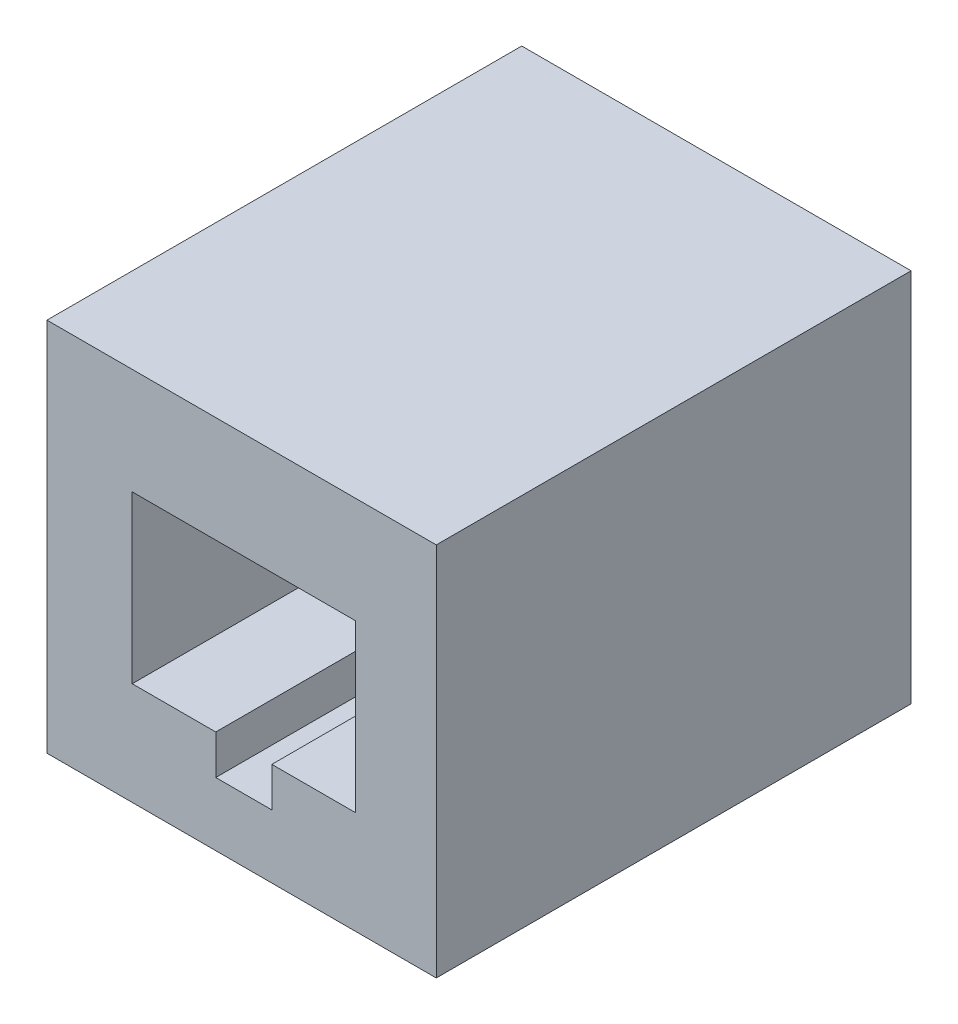
from build123d import *

# Parameters (mm, degrees)
SKETCH1_W           = 20.828
SKETCH1_H           = 20.066
BOSS_EXTRUDE1_DEPTH = 25.4
CAVITY1_START       = 4.562
CAVITY1_OUTLINE_W   = 8.89
CAVITY1_OUTLINE_H   = 14.9
CAVITY1_DEPTH       = 11.938
CAVITY1_START_2     = 9.031
CAVITY1_2_OUTLINE_W = 2.11
CAVITY1_2_OUTLINE_H = 14.9
CAVITY1_2_DEPTH     = 3


# Read off the part's stored shape, not the designer's step: Cavity1
with BuildPart() as part:
    # Sketch1 → Boss-Extrude1 (new body)
    with BuildSketch(Plane.XY):
        with Locations((10.414, 10.033)):
            Rectangle(SKETCH1_W, SKETCH1_H)
    extrude(amount=-BOSS_EXTRUDE1_DEPTH)

    # Cavity1 outline → Cavity1 (cut)
    with BuildSketch(Plane.YZ.offset(CAVITY1_START)):
        with Locations((9.945, -7.45)):
            Rectangle(CAVITY1_OUTLINE_W, CAVITY1_OUTLINE_H)
    extrude(amount=CAVITY1_DEPTH, mode=Mode.SUBTRACT)

    # Cavity1 2 outline → Cavity1 2 (cut)
    with BuildSketch(Plane.YZ.offset(CAVITY1_START_2)):
        with Locations((4.445, -7.45)):
            Rectangle(CAVITY1_2_OUTLINE_W, CAVITY1_2_OUTLINE_H)
    extrude(amount=CAVITY1_2_DEPTH, mode=Mode.SUBTRACT)


solid = part.part
